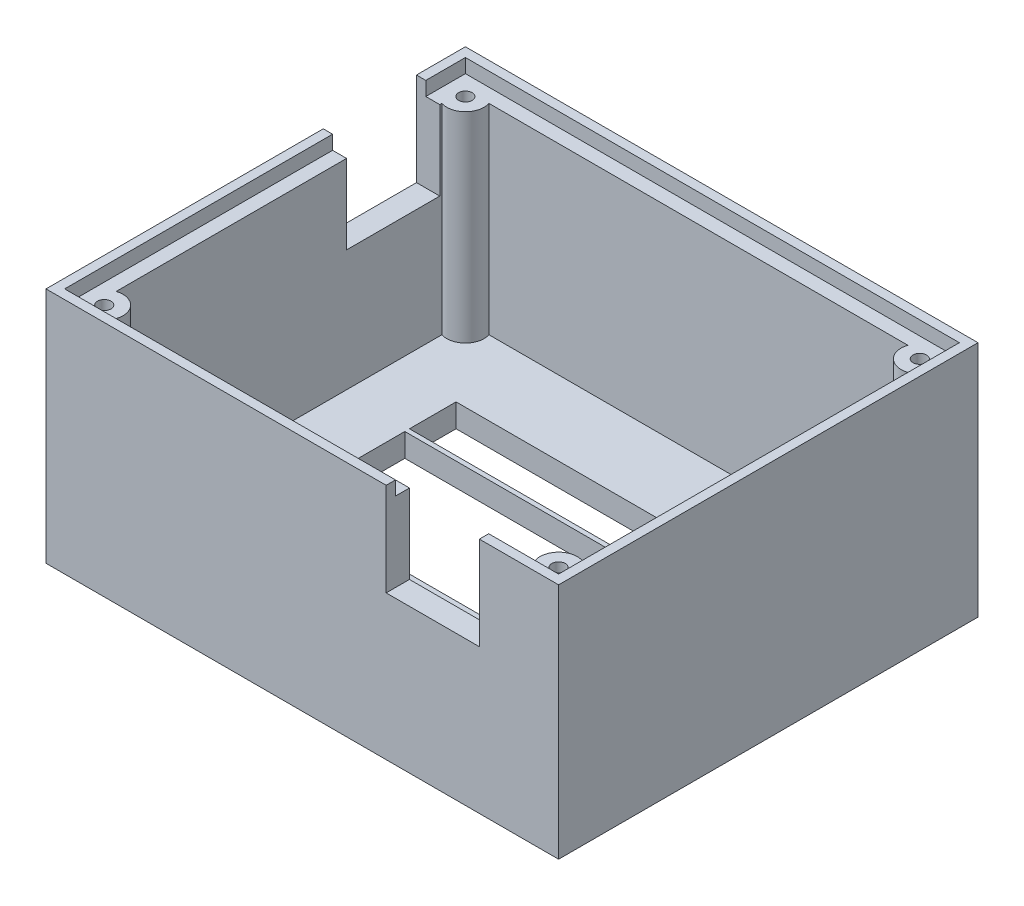
from build123d import *

# Parameters (mm, degrees)
SKETCH1_W                  = 110
SKETCH1_H                  = 90
BOSS_EXTRUDE1_DEPTH        = 51
SKETCH2_W                  = 100
SKETCH2_H                  = 80
CUT_EXTRUDE1_DEPTH         = 46
SKETCH3_W                  = 106
SKETCH3_H                  = 3
CUT_EXTRUDE2_DEPTH         = 3
SKETCH5_W                  = 3
SKETCH5_H                  = 83
CUT_EXTRUDE3_DEPTH         = 3
SKETCH6_W                  = 103
SKETCH6_H                  = 3
CUT_EXTRUDE4_DEPTH         = 3
SKETCH7_W                  = 3
SKETCH7_H                  = 80
CUT_EXTRUDE5_DEPTH         = 3
SKETCH9_R                  = 4
BOSS_EXTRUDE2_DEPTH        = 43
SKETCH10_R                 = 4
BOSS_EXTRUDE3_DEPTH        = 43
M2_5_CLEARANCE_HOLE1_D     = 2.9
M2_5_CLEARANCE_HOLE1_DEPTH = 5
M2_5_CLEARANCE_HOLE1_TIP   = 0.871247898
SKETCH14_W                 = 20
SKETCH14_H                 = 20
CUT_EXTRUDE6_DEPTH         = 5
SKETCH15_W                 = 20
SKETCH15_H                 = 20
CUT_EXTRUDE7_DEPTH         = 5
SKETCH16_W                 = 72
SKETCH16_H                 = 26
CUT_EXTRUDE8_DEPTH         = 5
SKETCH17_W                 = 72
SKETCH17_H                 = 10
CUT_EXTRUDE9_DEPTH         = 5
M6_CLEARANCE_HOLE2_D       = 6.6


with BuildPart() as part:
    # Sketch1 → Boss-Extrude1 (new body)
    with BuildSketch(Plane(origin=(0, 0, 0), x_dir=(1, 0, 0), z_dir=(0, 1, 0))):
        Rectangle(SKETCH1_W, SKETCH1_H)
    extrude(amount=BOSS_EXTRUDE1_DEPTH)

    # Sketch2 → Cut-Extrude1 (cut)
    with BuildSketch(Plane(origin=(0, 51, 0), x_dir=(1, 0, 0), z_dir=(0, 1, 0))):
        Rectangle(SKETCH2_W, SKETCH2_H)
    extrude(amount=-CUT_EXTRUDE1_DEPTH, mode=Mode.SUBTRACT)

    # Sketch3 → Cut-Extrude2 (cut)
    with BuildSketch(Plane(origin=(0, 51, 0), x_dir=(1, 0, 0), z_dir=(0, 1, 0))):
        with Locations((0, 41.5)):
            Rectangle(SKETCH3_W, SKETCH3_H)
    extrude(amount=-CUT_EXTRUDE2_DEPTH, mode=Mode.SUBTRACT)

    # Sketch5 → Cut-Extrude3 (cut)
    with BuildSketch(Plane(origin=(0, 51, 0), x_dir=(1, 0, 0), z_dir=(0, 1, 0))):
        with Locations((51.5, -1.5)):
            Rectangle(SKETCH5_W, SKETCH5_H)
    extrude(amount=-CUT_EXTRUDE3_DEPTH, mode=Mode.SUBTRACT)

    # Sketch6 → Cut-Extrude4 (cut)
    with BuildSketch(Plane(origin=(0, 51, 0), x_dir=(1, 0, 0), z_dir=(0, 1, 0))):
        with Locations((-1.5, -41.5)):
            Rectangle(SKETCH6_W, SKETCH6_H)
    extrude(amount=-CUT_EXTRUDE4_DEPTH, mode=Mode.SUBTRACT)

    # Sketch7 → Cut-Extrude5 (cut)
    with BuildSketch(Plane(origin=(0, 51, 0), x_dir=(1, 0, 0), z_dir=(0, 1, 0))):
        with Locations((-51.5, 0)):
            Rectangle(SKETCH7_W, SKETCH7_H)
    extrude(amount=-CUT_EXTRUDE5_DEPTH, mode=Mode.SUBTRACT)

    # Sketch9 → Boss-Extrude2 (add)
    with BuildSketch(Plane(origin=(0, 5, 0), x_dir=(1, 0, 0), z_dir=(0, 1, 0))):
        with Locations((-48.75, 38.75)):
            Circle(SKETCH9_R)
    extrude(amount=BOSS_EXTRUDE2_DEPTH)

    # Sketch10 → Boss-Extrude3 (add)
    with BuildSketch(Plane(origin=(0, 5, 0), x_dir=(1, 0, 0), z_dir=(0, 1, 0))):
        with Locations((48.75, 38.75)):
            Circle(SKETCH10_R)
        with Locations((48.75, -38.75)):
            Circle(SKETCH10_R)
        with Locations((-48.75, -38.75)):
            Circle(SKETCH10_R)
    extrude(amount=BOSS_EXTRUDE3_DEPTH)

    # M2.5 Clearance Hole1
    with Locations(Plane(origin=(0, 48, 0), x_dir=(1, 0, 0), z_dir=(0, 1, 0))):
        with Locations((-48.75, 38.75), (48.75, 38.75), (48.75, -38.75), (-48.75, -38.75)):
            Hole(M2_5_CLEARANCE_HOLE1_D / 2, depth=M2_5_CLEARANCE_HOLE1_DEPTH)
            with Locations((0, 0, -(M2_5_CLEARANCE_HOLE1_DEPTH + M2_5_CLEARANCE_HOLE1_TIP / 2))):  # 118° drill point
                Cone(0, M2_5_CLEARANCE_HOLE1_D / 2, M2_5_CLEARANCE_HOLE1_TIP, mode=Mode.SUBTRACT)

    # Sketch14 → Cut-Extrude6 (cut)
    with BuildSketch(Plane.ZY.offset(55)):
        with Locations((-24.5, 41)):
            Rectangle(SKETCH14_W, SKETCH14_H)
    extrude(amount=-CUT_EXTRUDE6_DEPTH, mode=Mode.SUBTRACT)

    # Sketch15 → Cut-Extrude7 (cut)
    with BuildSketch(Plane.XY.offset(45)):
        with Locations((28, 41)):
            Rectangle(SKETCH15_W, SKETCH15_H)
    extrude(amount=-CUT_EXTRUDE7_DEPTH, mode=Mode.SUBTRACT)

    # Sketch16 → Cut-Extrude8 (cut)
    with BuildSketch(Plane(origin=(0, 5, 0), x_dir=(1, 0, 0), z_dir=(0, 1, 0))):
        Rectangle(SKETCH16_W, SKETCH16_H)
    extrude(amount=-CUT_EXTRUDE8_DEPTH, mode=Mode.SUBTRACT)

    # Sketch17 → Cut-Extrude9 (cut)
    with BuildSketch(Plane.XZ):
        with Locations((0, -19)):
            Rectangle(SKETCH17_W, SKETCH17_H)
    extrude(amount=-CUT_EXTRUDE9_DEPTH, mode=Mode.SUBTRACT)

    # M6 Clearance Hole2 (through all)
    with Locations(Plane(origin=(0, 0, 0), x_dir=(-1, 0, 0), z_dir=(0, -1, 0))):
        with Locations((45.707468838, -9.899699144)):
            Hole(M6_CLEARANCE_HOLE2_D / 2)


solid = part.part
